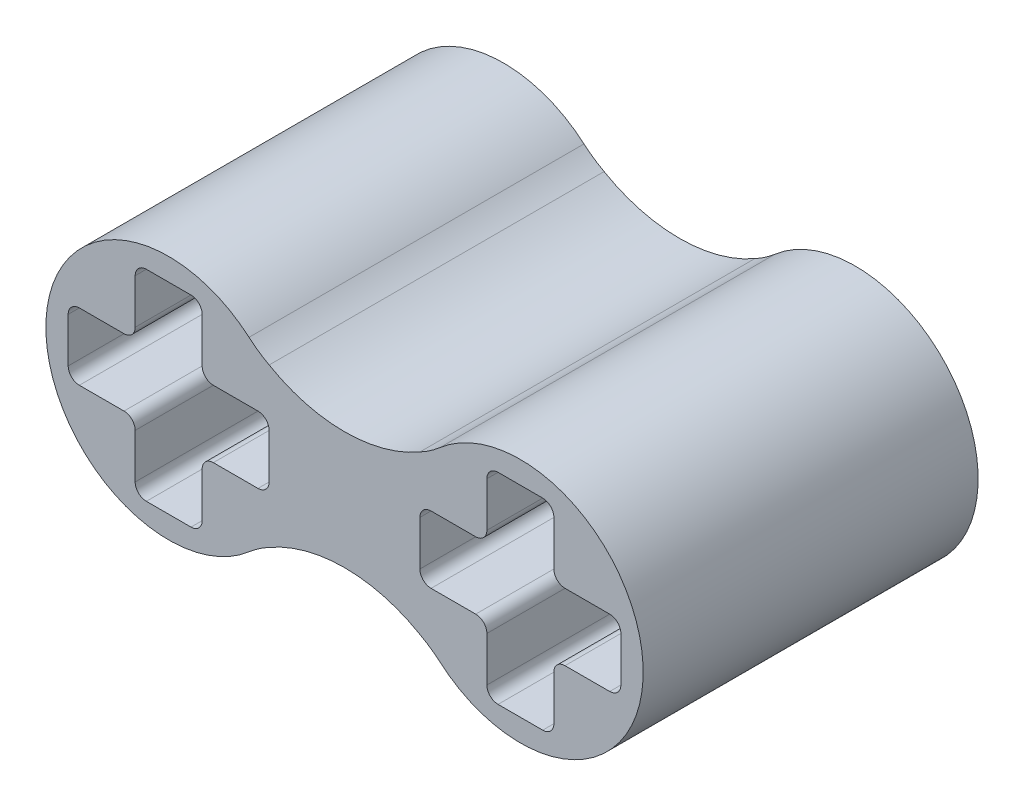
from build123d import *

# Parameters (mm, degrees)
SKETCH2_R          = 2.794
EXTRUDE1_DEPTH     = 7.62
CUT_EXTRUDE1_DEPTH = 9.583546586
LPATTERN1_COUNT    = 2
LPATTERN1_PITCH    = 8.001
EXTRUDE3_DEPTH     = 7.62
FILLET1_R          = 2.54


with BuildPart() as part:
    # Sketch2 → Extrude1 (new body)
    with BuildSketch(Plane.XY):
        with Locations(Location((0, 0, 0), (0, 0, 180))):
            Circle(SKETCH2_R)
    extrude(amount=EXTRUDE1_DEPTH)

    # Sketch3 → Cut-Extrude1 (cut, through all)
    with BuildSketch(Plane.XY.offset(7.62)):
        with BuildLine():
            Line((-0.762, 2.032), (-0.762, 1.016))
            ThreePointArc((-0.762, 1.016), (-0.836394878, 0.836394878), (-1.016, 0.762))
            Line((-1.016, 0.762), (-2.032, 0.762))
            ThreePointArc((-2.032, 0.762), (-2.211605122, 0.687605122), (-2.286, 0.508))
            Line((-2.286, 0.508), (-2.286, -0.508))
            ThreePointArc((-2.286, -0.508), (-2.211605122, -0.687605122), (-2.032, -0.762))
            Line((-2.032, -0.762), (-1.016, -0.762))
            ThreePointArc((-1.016, -0.762), (-0.836394878, -0.836394878), (-0.762, -1.016))
            Line((-0.762, -1.016), (-0.762, -2.032))
            ThreePointArc((-0.762, -2.032), (-0.687605122, -2.211605122), (-0.508, -2.286))
            Line((-0.508, -2.286), (0.508, -2.286))
            ThreePointArc((0.508, -2.286), (0.687605122, -2.211605122), (0.762, -2.032))
            Line((0.762, -2.032), (0.762, -1.016))
            ThreePointArc((0.762, -1.016), (0.836394878, -0.836394878), (1.016, -0.762))
            Line((1.016, -0.762), (2.032, -0.762))
            ThreePointArc((2.032, -0.762), (2.211605122, -0.687605122), (2.286, -0.508))
            Line((2.286, -0.508), (2.286, 0.508))
            ThreePointArc((2.286, 0.508), (2.211605122, 0.687605122), (2.032, 0.762))
            Line((2.032, 0.762), (1.016, 0.762))
            ThreePointArc((1.016, 0.762), (0.836394878, 0.836394878), (0.762, 1.016))
            Line((0.762, 1.016), (0.762, 2.032))
            ThreePointArc((0.762, 2.032), (0.687605122, 2.211605122), (0.508, 2.286))
            Line((0.508, 2.286), (-0.508, 2.286))
            ThreePointArc((-0.508, 2.286), (-0.687605122, 2.211605122), (-0.762, 2.032))
        make_face()
    extrude(amount=-CUT_EXTRUDE1_DEPTH, mode=Mode.SUBTRACT)


with BuildPart() as lpattern1_1:
    # LPattern1: pattern copy
    add(part.part.moved(Location(Vector(1, 0, 0) * (1 * LPATTERN1_PITCH))))


with BuildPart() as part_1:
    add(part.part)

    add(lpattern1_1.part)  # Extrude3 merges LPattern1_1
    # Sketch5 → Extrude3 (add, through all)
    with BuildSketch(Plane.XY.offset(7.62)):
        with BuildLine():
            Line((2.286, 1.797323066), (2.286, -1.797323066))
            ThreePointArc((2.286, -1.797323066), (4.0005, -1.338121812), (5.715, -1.797323066))
            Line((5.715, -1.797323066), (5.715, 1.797323066))
            ThreePointArc((5.715, 1.797323066), (4.0005, 1.338121812), (2.286, 1.797323066))
        make_face()
    extrude(amount=-EXTRUDE3_DEPTH)

    # Fillet1
    # the kernel refuses this fillet: 2.54 mm, written as the material it adds along each edge
    with BuildSketch(Plane(origin=(2.286, 1.606437051, 7.62), x_dir=(-0.6706382745586644, 0.7417845406160589, 0), z_dir=(0, 0, -1))) as fillet1_piece_1:
        with BuildLine():
            CenterArc((0.993305965, 2.520961484), FILLET1_R, 250.408076785, 12.572378174)
            Line((0.141596295, 0.128015467), (0, 0))
            ThreePointArc((0, 0), (0.341448925, 0.020942368), (0.682897851, 0))
        make_face()
    extrude(amount=7.62)
    with BuildSketch(Plane(origin=(2.286, -1.606437051, 7.62), x_dir=(-0.6706382745586632, -0.7417845406160598, 0), z_dir=(0, 0, -1))) as fillet1_piece_2:
        with BuildLine():
            CenterArc((0.993305965, -2.520961484), FILLET1_R, 97.019545041, 12.572378174)
            Line((0.141596295, -0.128015467), (0, 0))
            ThreePointArc((0, 0), (0.341448925, -0.020942368), (0.682897851, 0))
        make_face()
    extrude(amount=7.62)
    with BuildSketch(Plane(origin=(5.715, -1.606437051, 7.62), x_dir=(0, -1, 0), z_dir=(0, 0, -1))) as fillet1_piece_3:
        with BuildLine():
            CenterArc((2.427472269, 1.203861258), FILLET1_R, 208.291730517, 12.572378174)
            ThreePointArc((0.506563069, -0.457977436), (0.267326288, -0.213453994), (0, 0))
            Line((0, 0), (0.190886015, 0))
        make_face()
    extrude(amount=7.62)
    with BuildSketch(Plane(origin=(5.715, 1.606437051, 7.62), x_dir=(0, 1, 0), z_dir=(0, 0, -1))) as fillet1_piece_4:
        with BuildLine():
            CenterArc((2.427472269, -1.203861258), FILLET1_R, 139.135891309, 12.572378174)
            ThreePointArc((0.506563069, 0.457977436), (0.267326288, 0.213453994), (0, 0))
            Line((0, 0), (0.190886015, 0))
        make_face()
    extrude(amount=7.62)


solid = part_1.part
